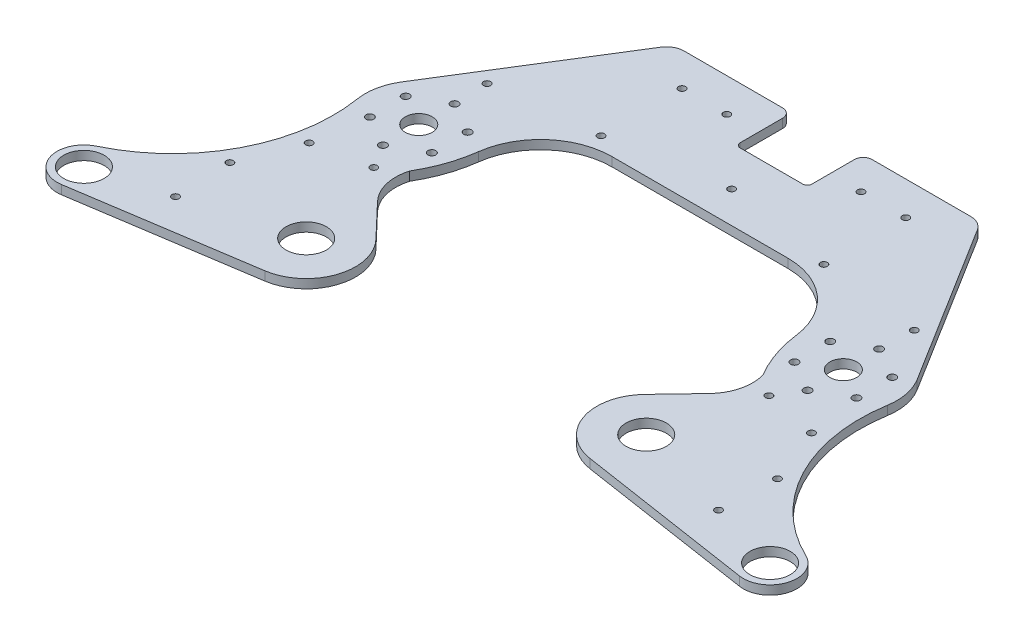
from build123d import *

# Parameters (mm, degrees)
CROQUIS2_R              = 14.3256
SALIENTE_EXTRUIR1_DEPTH = 6.35
CROQUIS2_4_W            = 50.8762
CROQUIS2_4_H            = 39.6875
CROQUIS2_4_R            = 9.5631
CROQUIS2_4_R_2          = 2.75
CORTAR_EXTRUIR1_DEPTH   = 363.052963889
CROQUIS14_R             = 2.4892
CORTAR_EXTRUIR2_DEPTH   = 363.052963889
REDONDEO1_R             = 6.35
REDONDEO2_R             = 3.175


with BuildPart() as part:
    # Croquis2 → Saliente-Extruir1 (new body)
    with BuildSketch(Plane(origin=(0, 0, 0), x_dir=(1, 0, 0), z_dir=(0, 1, 0))):
        with BuildLine():
            ThreePointArc((-188.182128671, 103.759608663), (-199.701715383, 32.430892727), (-251.69762296, -17.737944119))
            ThreePointArc((-251.69762296, -17.737944119), (-261.686817555, -40.53413651), (-240.600442924, -53.755906478))
            Line((-240.600442924, -53.755906478), (-115.357366493, -34.595379464))
            ThreePointArc((-115.357366493, -34.595379464), (-87.525854425, -11.297930327), (-95.320323823, 24.150771302))
            Line((-95.320323823, 24.150771302), (-117.919425507, 47.853034074))
            ThreePointArc((-117.919425507, 47.853034074), (-125.667640352, 61.991051501), (-125.359085671, 78.110082616))
            ThreePointArc((-125.359085671, 78.110082616), (-117.209880411, 95.622258218), (-112.798586764, 114.427213125))
            ThreePointArc((-112.798586764, 114.427213125), (-95.966139935, 146.092380804), (-62.413214778, 158.75))
            Line((-62.413214778, 158.75), (62.413214778, 158.75))
            ThreePointArc((62.413214778, 158.75), (95.966139935, 146.092380804), (112.798586764, 114.427213125))
            ThreePointArc((112.798586764, 114.427213125), (117.209880411, 95.622258218), (125.359085671, 78.110082616))
            ThreePointArc((125.359085671, 78.110082616), (125.667640352, 61.991051501), (117.919425507, 47.853034074))
            Line((117.919425507, 47.853034074), (95.320323823, 24.150771302))
            ThreePointArc((95.320323823, 24.150771302), (87.525854425, -11.297930327), (115.357366493, -34.595379464))
            Line((115.357366493, -34.595379464), (240.600442924, -53.755906478))
            ThreePointArc((240.600442924, -53.755906478), (261.686817555, -40.53413651), (251.69762296, -17.737944119))
            ThreePointArc((251.69762296, -17.737944119), (199.701715383, 32.430892727), (188.182128671, 103.759608663))
            ThreePointArc((188.182128671, 103.759608663), (187.935440804, 117.344782165), (182.928449722, 129.976006741))
            Line((182.928449722, 129.976006741), (112.380211411, 243.251443844))
            ThreePointArc((112.380211411, 243.251443844), (107.765343185, 247.640587112), (101.6, 249.2375))
            Line((101.6, 249.2375), (-101.6, 249.2375))
            ThreePointArc((-101.6, 249.2375), (-107.765343185, 247.640587112), (-112.380211411, 243.251443844))
            Line((-112.380211411, 243.251443844), (-182.928449722, 129.976006741))
            ThreePointArc((-182.928449722, 129.976006741), (-187.935440804, 117.344782165), (-188.182128671, 103.759608663))
        make_face()
        with Locations((-243.481321473, -34.925)):
            Circle(CROQUIS2_R, mode=Mode.SUBTRACT)
        with Locations((243.481321473, -34.925)):
            Circle(CROQUIS2_R, mode=Mode.SUBTRACT)
        with Locations((120.65, 0)):
            Circle(CROQUIS2_R, mode=Mode.SUBTRACT)
        with Locations((-120.65, 0)):
            Circle(CROQUIS2_R, mode=Mode.SUBTRACT)
    extrude(amount=SALIENTE_EXTRUIR1_DEPTH)

    # Croquis2<4> → Cortar-Extruir1 (cut, through all)
    with BuildSketch(Plane(origin=(0, 0, 0), x_dir=(1, 0, 0), z_dir=(0, 1, 0))):
        with Locations((0, 229.39375)):
            Rectangle(CROQUIS2_4_W, CROQUIS2_4_H)
        with Locations((150.65, 109.872903883)):
            Circle(CROQUIS2_4_R)
        with Locations((-150.65, 135.272903883)):
            Circle(CROQUIS2_4_R_2)
        with Locations((-128.652954744, 122.572903883)):
            Circle(CROQUIS2_4_R_2)
        with Locations((-128.652954744, 97.172903883)):
            Circle(CROQUIS2_4_R_2)
        with Locations((-150.65, 84.472903883)):
            Circle(CROQUIS2_4_R_2)
        with Locations((-172.647045256, 97.172903883)):
            Circle(CROQUIS2_4_R_2)
        with Locations((-172.647045256, 122.572903883)):
            Circle(CROQUIS2_4_R_2)
        with Locations((172.647045256, 122.572903883)):
            Circle(CROQUIS2_4_R_2)
        with Locations((172.647045256, 97.172903883)):
            Circle(CROQUIS2_4_R_2)
        with Locations((150.65, 84.472903883)):
            Circle(CROQUIS2_4_R_2)
        with Locations((128.652954744, 97.172903883)):
            Circle(CROQUIS2_4_R_2)
        with Locations((128.652954744, 122.572903883)):
            Circle(CROQUIS2_4_R_2)
        with Locations((150.65, 135.272903883)):
            Circle(CROQUIS2_4_R_2)
        with Locations((-150.65, 109.872903883)):
            Circle(CROQUIS2_4_R)
    extrude(amount=CORTAR_EXTRUIR1_DEPTH, mode=Mode.SUBTRACT)

    # Croquis14 → Cortar-Extruir2 (cut, through all)
    with BuildSketch(Plane(origin=(0, 6.35, 0), x_dir=(1, 0, 0), z_dir=(0, 1, 0))):
        with Locations((0, 181.2925)):
            Circle(CROQUIS14_R)
        with Locations((-192.681321473, -20.729393931)):
            Circle(CROQUIS14_R)
        with Locations((-194.31, 19.456295642)):
            Circle(CROQUIS14_R)
        with Locations((-178.243269302, 59.69)):
            Circle(CROQUIS14_R)
        with Locations((-47.625, 225.425)):
            Circle(CROQUIS14_R)
        with Locations((-79.375, 225.425)):
            Circle(CROQUIS14_R)
        with Locations((-140.226260019, 67.490403883)):
            Circle(CROQUIS14_R)
        with Locations((47.625, 225.425)):
            Circle(CROQUIS14_R)
        with Locations((79.375, 225.425)):
            Circle(CROQUIS14_R)
        with Locations((-79.052222899, 167.64)):
            Circle(CROQUIS14_R)
        with Locations((-151.595435894, 159.265462799)):
            Circle(CROQUIS14_R)
        with Locations((192.681321473, -20.729393931)):
            Circle(CROQUIS14_R)
        with Locations((194.31, 19.456295642)):
            Circle(CROQUIS14_R)
        with Locations((178.243269302, 59.69)):
            Circle(CROQUIS14_R)
        with Locations((140.226260019, 67.490403883)):
            Circle(CROQUIS14_R)
        with Locations((79.052222899, 167.64)):
            Circle(CROQUIS14_R)
        with Locations((151.595435894, 159.265462799)):
            Circle(CROQUIS14_R)
    extrude(amount=-CORTAR_EXTRUIR2_DEPTH, mode=Mode.SUBTRACT)

    # Redondeo1
    redondeo1_edges = [part.edges().sort_by_distance(p)[0] for p in [
        (25.4381, 3.175, -249.2375),
        (-25.4381, 3.175, -249.2375),
    ]]
    fillet(redondeo1_edges, radius=REDONDEO1_R)

    # Redondeo2
    redondeo2_edges = [part.edges().sort_by_distance(p)[0] for p in [
        (-25.4381, 3.175, -209.55),
        (25.4381, 3.175, -209.55),
    ]]
    fillet(redondeo2_edges, radius=REDONDEO2_R)


solid = part.part
